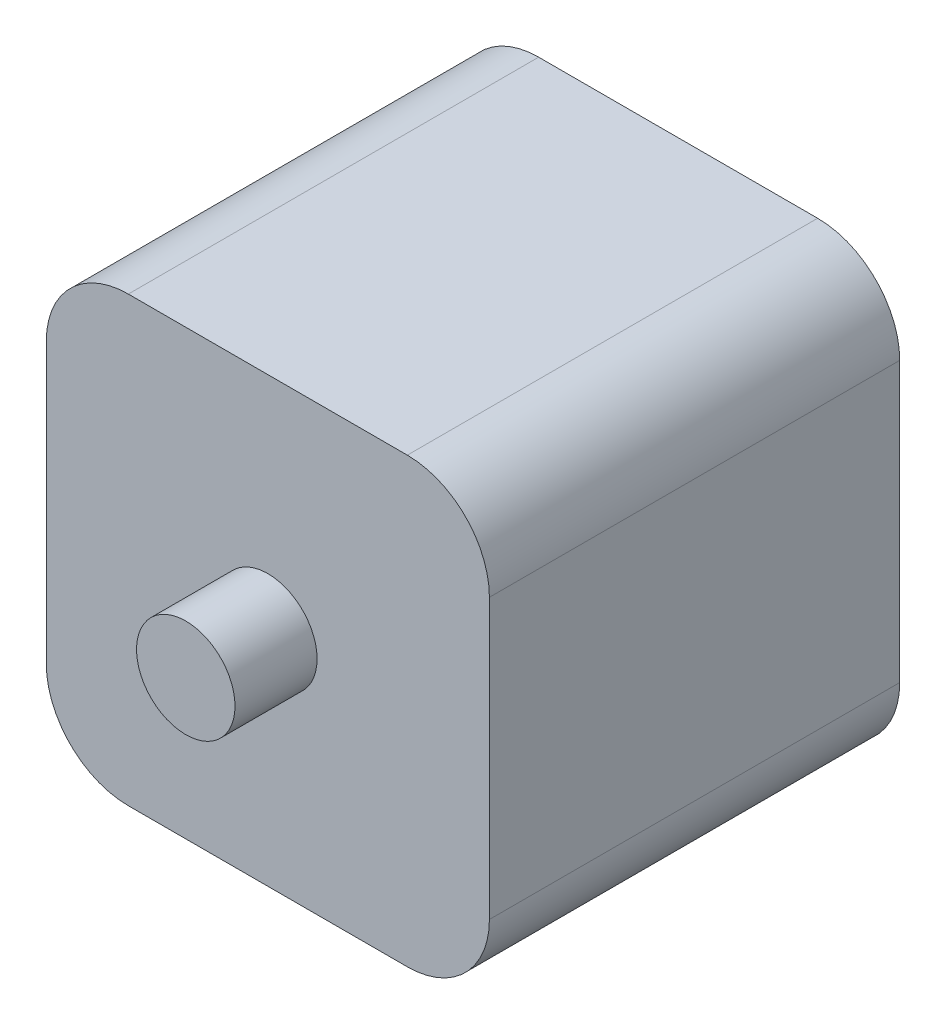
from build123d import *

# Parameters (mm, degrees)
BOSS_EXTRU_5_DEPTH = 15
BOSS_EXTRU_6_DEPTH = 10
ESQUISSE7_R        = 3
BOSS_EXTRU_7_DEPTH = 5


# Read off the part's stored shape, not the designer's step: Boss.-Extru.5
with BuildPart() as part:
    # Boss.-Extru.5 outline → Boss.-Extru.5 (new body)
    # profile 1 of 2: a face of its own
    with BuildSketch(Plane.XY):
        with BuildLine():
            Line((-8.5, -13.5), (8.5, -13.5))
            ThreePointArc((8.5, -13.5), (12.035533906, -12.035533906), (13.5, -8.5))
            Line((13.5, -8.5), (13.5, 8.5))
            ThreePointArc((13.5, 8.5), (12.035533906, 12.035533906), (8.5, 13.5))
            Line((8.5, 13.5), (-8.5, 13.5))
            ThreePointArc((-8.5, 13.5), (-12.035533906, 12.035533906), (-13.5, 8.5))
            Line((-13.5, 8.5), (-13.5, -8.5))
            ThreePointArc((-13.5, -8.5), (-12.035533906, -12.035533906), (-8.5, -13.5))
        make_face()
        with BuildLine():
            Line((-10, 3.5), (-10, 8.5))
            ThreePointArc((-10, 8.5), (-9.560660172, 9.560660172), (-8.5, 10))
            Line((-8.5, 10), (-3.5, 10))
            Line((-3.5, 10), (-3.5, 9.5))
            Line((-3.5, 9.5), (-3, 9.5))
            Line((-3, 9.5), (-3, 8.5))
            Line((-3, 8.5), (-6, 8.5))
            Line((-6, 8.5), (-6, 7.060660172))
            Line((-6, 7.060660172), (-3.439339828, 4.5))
            Line((-3.439339828, 4.5), (-0.866025404, 4.5))
            Line((-0.866025404, 4.5), (0, 4))
            Line((0, 4), (0.866025404, 4.5))
            Line((0.866025404, 4.5), (3.439339828, 4.5))
            Line((3.439339828, 4.5), (6, 7.060660172))
            Line((6, 7.060660172), (6, 8.5))
            Line((6, 8.5), (3, 8.5))
            Line((3, 8.5), (3, 9.5))
            Line((3, 9.5), (3.5, 9.5))
            Line((3.5, 9.5), (3.5, 10))
            Line((3.5, 10), (8.5, 10))
            ThreePointArc((8.5, 10), (9.560660172, 9.560660172), (10, 8.5))
            Line((10, 8.5), (10, 3.5))
            Line((10, 3.5), (9.5, 3.5))
            Line((9.5, 3.5), (9.5, 3))
            Line((9.5, 3), (8.5, 3))
            Line((8.5, 3), (8.5, 6))
            Line((8.5, 6), (7.060660172, 6))
            Line((7.060660172, 6), (4.5, 3.439339828))
            Line((4.5, 3.439339828), (4.5, 0.866025404))
            Line((4.5, 0.866025404), (4, 0))
            Line((4, 0), (4.5, -0.866025404))
            Line((4.5, -0.866025404), (4.5, -3.439339828))
            Line((4.5, -3.439339828), (7.060660172, -6))
            Line((7.060660172, -6), (8.5, -6))
            Line((8.5, -6), (8.5, -3))
            Line((8.5, -3), (9.5, -3))
            Line((9.5, -3), (9.5, -3.5))
            Line((9.5, -3.5), (10, -3.5))
            Line((10, -3.5), (10, -8.5))
            ThreePointArc((10, -8.5), (9.560660172, -9.560660172), (8.5, -10))
            Line((8.5, -10), (3.5, -10))
            Line((3.5, -10), (3.5, -9.5))
            Line((3.5, -9.5), (3, -9.5))
            Line((3, -9.5), (3, -8.5))
            Line((3, -8.5), (6, -8.5))
            Line((6, -8.5), (6, -7.060660172))
            Line((6, -7.060660172), (3.439339828, -4.5))
            Line((3.439339828, -4.5), (0.866025404, -4.5))
            Line((0.866025404, -4.5), (0, -4))
            Line((0, -4), (-0.866025404, -4.5))
            Line((-0.866025404, -4.5), (-3.439339828, -4.5))
            Line((-3.439339828, -4.5), (-6, -7.060660172))
            Line((-6, -7.060660172), (-6, -8.5))
            Line((-6, -8.5), (-3, -8.5))
            Line((-3, -8.5), (-3, -9.5))
            Line((-3, -9.5), (-3.5, -9.5))
            Line((-3.5, -9.5), (-3.5, -10))
            Line((-3.5, -10), (-8.5, -10))
            ThreePointArc((-8.5, -10), (-9.560660172, -9.560660172), (-10, -8.5))
            Line((-10, -8.5), (-10, -3.5))
            Line((-10, -3.5), (-9.5, -3.5))
            Line((-9.5, -3.5), (-9.5, -3))
            Line((-9.5, -3), (-8.5, -3))
            Line((-8.5, -3), (-8.5, -6))
            Line((-8.5, -6), (-7.060660172, -6))
            Line((-7.060660172, -6), (-4.5, -3.439339828))
            Line((-4.5, -3.439339828), (-4.5, -0.866025404))
            Line((-4.5, -0.866025404), (-4, 0))
            Line((-4, 0), (-4.5, 0.866025404))
            Line((-4.5, 0.866025404), (-4.5, 3.439339828))
            Line((-4.5, 3.439339828), (-7.060660172, 6))
            Line((-7.060660172, 6), (-8.5, 6))
            Line((-8.5, 6), (-8.5, 3))
            Line((-8.5, 3), (-9.5, 3))
            Line((-9.5, 3), (-9.5, 3.5))
            Line((-9.5, 3.5), (-10, 3.5))
        make_face(mode=Mode.SUBTRACT)
    # profile 2 of 2: a face of its own
    with BuildSketch(Plane.XY):
        with BuildLine():
            Line((1.949592103, 3.000876196), (1.276279893, 2.435900169))
            ThreePointArc((1.276279893, 2.435900169), (0.001756003, 2.749999439), (-1.273167982, 2.43752811))
            Line((-1.273167982, 2.43752811), (-1.947287092, 3.003181207))
            Line((-1.947287092, 3.003181207), (-3.000876196, 1.949592103))
            Line((-3.000876196, 1.949592103), (-2.435900169, 1.276279893))
            ThreePointArc((-2.435900169, 1.276279893), (-2.749999439, 0.001756003), (-2.43752811, -1.273167982))
            Line((-2.43752811, -1.273167982), (-3.003181207, -1.947287092))
            Line((-3.003181207, -1.947287092), (-1.949592103, -3.000876196))
            Line((-1.949592103, -3.000876196), (-1.276279893, -2.435900169))
            ThreePointArc((-1.276279893, -2.435900169), (-0.001756003, -2.749999439), (1.273167982, -2.43752811))
            Line((1.273167982, -2.43752811), (1.947287092, -3.003181207))
            Line((1.947287092, -3.003181207), (3.000876196, -1.949592103))
            Line((3.000876196, -1.949592103), (2.435900169, -1.276279893))
            ThreePointArc((2.435900169, -1.276279893), (2.749999439, -0.001756003), (2.43752811, 1.273167982))
            Line((2.43752811, 1.273167982), (3.003181207, 1.947287092))
            Line((3.003181207, 1.947287092), (1.949592103, 3.000876196))
        make_face()
    extrude(amount=BOSS_EXTRU_5_DEPTH)

    # Esquisse6 → Boss.-Extru.6 (add)
    with BuildSketch(Plane.XY.offset(15)):
        with BuildLine():
            Line((-13.5, 8.5), (-13.5, -8.5))
            ThreePointArc((-13.5, -8.5), (-12.035533906, -12.035533906), (-8.5, -13.5))
            Line((-8.5, -13.5), (8.5, -13.5))
            ThreePointArc((8.5, -13.5), (12.035533906, -12.035533906), (13.5, -8.5))
            Line((13.5, -8.5), (13.5, 8.5))
            ThreePointArc((13.5, 8.5), (12.035533906, 12.035533906), (8.5, 13.5))
            Line((8.5, 13.5), (-8.5, 13.5))
            ThreePointArc((-8.5, 13.5), (-12.035533906, 12.035533906), (-13.5, 8.5))
        make_face()
    extrude(amount=BOSS_EXTRU_6_DEPTH)

    # Esquisse7 → Boss.-Extru.7 (add)
    with BuildSketch(Plane.XY.offset(25)):
        Circle(ESQUISSE7_R)
    extrude(amount=BOSS_EXTRU_7_DEPTH)


solid = part.part
